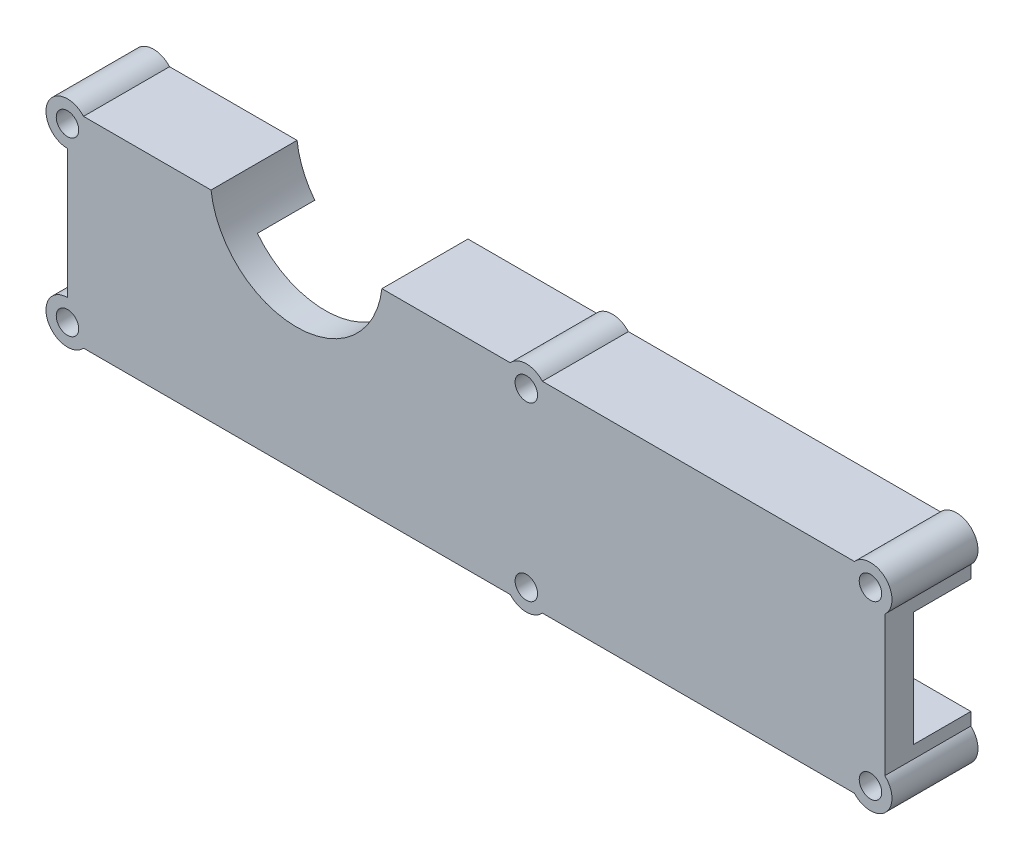
from build123d import *

# Parameters (mm, degrees)
SKETCH1_R           = 2.4892
BOSS_EXTRUDE1_DEPTH = 19.05
SKETCH2_W           = 12.7
SKETCH2_H           = 25.4
CUT_EXTRUDE1_DEPTH  = 189.491810996


with BuildPart() as part:
    # Sketch1 → Boss-Extrude1 (new body)
    with BuildSketch(Plane.XY):
        with BuildLine():
            ThreePointArc((-3.549757914, -3.175), (0, -4.7625), (3.549757914, -3.175))
            Line((3.549757914, -3.175), (72.650242086, -3.175))
            ThreePointArc((72.650242086, -3.175), (79.567596045, -3.367596045), (79.375, 3.549757914))
            Line((79.375, 3.549757914), (79.375, 34.550242086))
            ThreePointArc((79.375, 34.550242086), (79.567596045, 41.467596045), (72.650242086, 41.275))
            Line((72.650242086, 41.275), (3.549757914, 41.275))
            ThreePointArc((3.549757914, 41.275), (0, 42.8625), (-3.549757914, 41.275))
            Line((-3.549757914, 41.275), (-31.972901617, 41.275))
            ThreePointArc((-31.972901617, 41.275), (-50.8928116, 24.4475), (-69.812721583, 41.275))
            Line((-69.812721583, 41.275), (-98.050242086, 41.275))
            ThreePointArc((-98.050242086, 41.275), (-105.9475478, 40.044282483), (-101.6, 33.3375))
            Line((-101.6, 33.3375), (-101.6, 4.7625))
            ThreePointArc((-101.6, 4.7625), (-105.9475478, -1.944282483), (-98.050242086, -3.175))
            Line((-98.050242086, -3.175), (-3.549757914, -3.175))
        make_face()
        with Locations((-101.6, 0)):
            Circle(SKETCH1_R, mode=Mode.SUBTRACT)
        Circle(SKETCH1_R, mode=Mode.SUBTRACT)
        with Locations((-101.6, 38.1)):
            Circle(SKETCH1_R, mode=Mode.SUBTRACT)
        with Locations((0, 38.1)):
            Circle(SKETCH1_R, mode=Mode.SUBTRACT)
        with Locations((76.2, 38.1)):
            Circle(SKETCH1_R, mode=Mode.SUBTRACT)
        with Locations((76.2, 0)):
            Circle(SKETCH1_R, mode=Mode.SUBTRACT)
    extrude(amount=BOSS_EXTRUDE1_DEPTH)

    # Sketch2 → Cut-Extrude1 (cut, through all)
    with BuildSketch(Plane.ZY.offset(101.6)):
        with Locations((6.35, 19.05)):
            Rectangle(SKETCH2_W, SKETCH2_H)
    extrude(amount=-CUT_EXTRUDE1_DEPTH, mode=Mode.SUBTRACT)


solid = part.part
